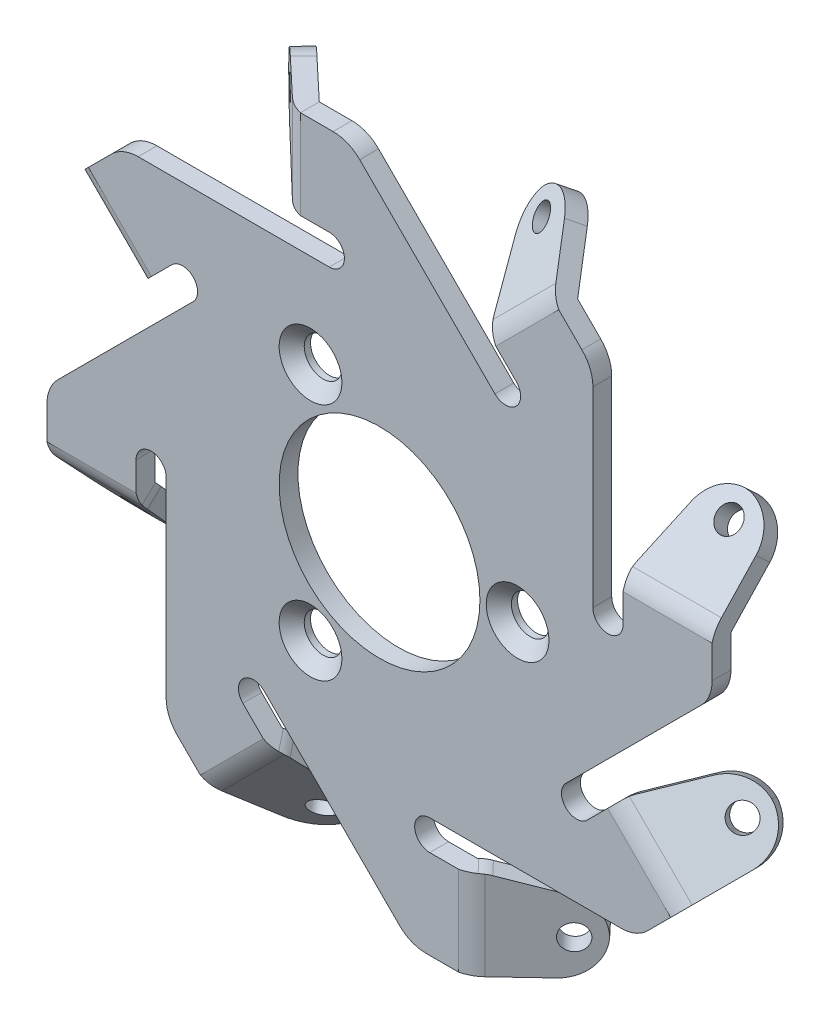
from build123d import *

# Parameters (mm, degrees)
ESQUISSE1_W                    = 53
ESQUISSE1_H                    = 53
BOSS_EXTRU_1_DEPTH             = 1.5
ESQUISSE5_R                    = 8
ENL_V_MAT_EXTRU_4_DEPTH        = 38.506666074
ENL_V_MAT_EXTRU_1_DEPTH        = 38.506666074
ESQUISSE3_W                    = 15
ESQUISSE3_H                    = 20.2
ESQUISSE3_W_2                  = 20.2
ESQUISSE3_H_2                  = 15
ENL_V_MAT_EXTRU_2_DEPTH        = 38.506666074
ENL_V_MAT_EXTRU_3_DEPTH        = 1.5
BOSS_EXTRU_2_DEPTH             = 7.1
R_P_TITION_CIRCULAIRE6_COUNT   = 8
ESQUISSE14_R                   = 1
ENL_V_MAT_EXTRU_5_DEPTH        = 44.23397886
R_P_TITION_CIRCULAIRE7_COUNT   = 8
CONG_1_R                       = 3
R_P_TITION_START               = -5.820655623
R_P_TITION_CIRCULAIRE8_DEPTH   = 1.5
R_P_TITION_CIRCULAIRE8_2_DEPTH = 1.5
R_P_TITION_START_2             = 4.320655623
R_P_TITION_CIRCULAIRE8_3_DEPTH = 1.5
R_P_TITION_CIRCULAIRE8_4_DEPTH = 1.5
R_P_TITION_CIRCULAIRE8_5_DEPTH = 1.5
R_P_TITION_CIRCULAIRE8_6_DEPTH = 1.5
R_P_TITION_CIRCULAIRE8_7_DEPTH = 1.5
CONG_2_R                       = 3
R_P_TITION_START_3             = -26.5
R_P_TITION_CIRCULAIRE9_DEPTH   = 7.1
R_P_TITION_START_4             = 19.4
R_P_TITION_CIRCULAIRE9_2_DEPTH = 7.1
R_P_TITION_CIRCULAIRE9_3_DEPTH = 7.1
R_P_TITION_CIRCULAIRE9_4_DEPTH = 7.1
R_P_TITION_CIRCULAIRE9_5_DEPTH = 7.1
R_P_TITION_CIRCULAIRE9_6_DEPTH = 7.1
R_P_TITION_CIRCULAIRE9_7_DEPTH = 7.1
CONG_3_R                       = 3
R_P_TITION_CIRCULAIRE10_DEPTH  = 1.5
ESQUISSE15_R                   = 1.5
ENL_V_MAT_EXTRU_6_DEPTH        = 39.393130179
CHANFREIN1_SIZE                = 1


# Read off the part's stored shape, not the designer's step: Répétition circulaire8, Répétition circulaire9, Répétition circulaire10
with BuildPart() as part:
    # Esquisse1 → Boss.-Extru.1 (new body)
    with BuildSketch(Plane.XY):
        Rectangle(ESQUISSE1_W, ESQUISSE1_H)
    extrude(amount=BOSS_EXTRU_1_DEPTH)

    # Esquisse5 → Enlèv. mat.-Extru.4 (cut, through all)
    with BuildSketch(Plane.XY.offset(1.5)):
        Circle(ESQUISSE5_R)
    extrude(amount=-ENL_V_MAT_EXTRU_4_DEPTH, mode=Mode.SUBTRACT)

    # Esquisse2 → Enlèv. mat.-Extru.1 (cut, through all)
    with BuildSketch(Plane.XY.offset(1.5)):
        with BuildLine():
            Line((19.4, 26.5), (19.4, 4))
            ThreePointArc((19.4, 4), (18.2, 2.8), (17, 4))
            Line((17, 4), (17, 26.5))
            ThreePointArc((17, 26.5), (18.2, 27.7), (19.4, 26.5))
        make_face()
        with BuildLine():
            Line((32.456201256, 5.020458146), (16.54629868, -10.88944443))
            ThreePointArc((16.54629868, -10.88944443), (14.849242405, -10.88944443), (14.849242405, -9.192388155))
            Line((14.849242405, -9.192388155), (30.759144982, 6.717514421))
            ThreePointArc((30.759144982, 6.717514421), (32.456201256, 6.717514421), (32.456201256, 5.020458146))
        make_face()
        with BuildLine():
            Line((26.5, -19.4), (4, -19.4))
            ThreePointArc((4, -19.4), (2.8, -18.2), (4, -17))
            Line((4, -17), (26.5, -17))
            ThreePointArc((26.5, -17), (27.7, -18.2), (26.5, -19.4))
        make_face()
        with BuildLine():
            Line((5.020458146, -32.456201256), (-10.88944443, -16.54629868))
            ThreePointArc((-10.88944443, -16.54629868), (-10.88944443, -14.849242405), (-9.192388155, -14.849242405))
            Line((-9.192388155, -14.849242405), (6.717514421, -30.759144982))
            ThreePointArc((6.717514421, -30.759144982), (6.717514421, -32.456201256), (5.020458146, -32.456201256))
        make_face()
        with BuildLine():
            Line((-19.4, -26.5), (-19.4, -4))
            ThreePointArc((-19.4, -4), (-18.2, -2.8), (-17, -4))
            Line((-17, -4), (-17, -26.5))
            ThreePointArc((-17, -26.5), (-18.2, -27.7), (-19.4, -26.5))
        make_face()
        with BuildLine():
            Line((-32.456201256, -5.020458146), (-16.54629868, 10.88944443))
            ThreePointArc((-16.54629868, 10.88944443), (-14.849242405, 10.88944443), (-14.849242405, 9.192388155))
            Line((-14.849242405, 9.192388155), (-30.759144982, -6.717514421))
            ThreePointArc((-30.759144982, -6.717514421), (-32.456201256, -6.717514421), (-32.456201256, -5.020458146))
        make_face()
        with BuildLine():
            Line((-26.5, 19.4), (-4, 19.4))
            ThreePointArc((-4, 19.4), (-2.8, 18.2), (-4, 17))
            Line((-4, 17), (-26.5, 17))
            ThreePointArc((-26.5, 17), (-27.7, 18.2), (-26.5, 19.4))
        make_face()
        with BuildLine():
            Line((-5.020458146, 32.456201256), (10.88944443, 16.54629868))
            ThreePointArc((10.88944443, 16.54629868), (10.88944443, 14.849242405), (9.192388155, 14.849242405))
            Line((9.192388155, 14.849242405), (-6.717514421, 30.759144982))
            ThreePointArc((-6.717514421, 30.759144982), (-6.717514421, 32.456201256), (-5.020458146, 32.456201256))
        make_face()
    extrude(amount=-ENL_V_MAT_EXTRU_1_DEPTH, mode=Mode.SUBTRACT)

    # Esquisse3 → Enlèv. mat.-Extru.2 (cut, through all)
    with BuildSketch(Plane.XY.offset(1.5)):
        with Locations((26.9, 16.4)):
            Rectangle(ESQUISSE3_W, ESQUISSE3_H)
        Polygon((18.172644276, -9.263098834), (28.779245994, -19.869700551), (43.062802974, -5.586143571), (32.456201256, 5.020458146), align=None)
        with Locations((16.4, -26.9)):
            Rectangle(ESQUISSE3_W_2, ESQUISSE3_H_2)
        Polygon((-9.263098834, -18.172644276), (-19.869700551, -28.779245994), (-5.586143571, -43.062802974), (5.020458146, -32.456201256), align=None)
        with Locations((-26.9, -16.4)):
            Rectangle(ESQUISSE3_W, ESQUISSE3_H)
        Polygon((-18.172644276, 9.263098834), (-28.779245994, 19.869700551), (-43.062802974, 5.586143571), (-32.456201256, -5.020458146), align=None)
        with Locations((-16.4, 26.9)):
            Rectangle(ESQUISSE3_W_2, ESQUISSE3_H_2)
        Polygon((9.263098834, 18.172644276), (19.869700551, 28.779245994), (5.586143571, 43.062802974), (-5.020458146, 32.456201256), align=None)
    extrude(amount=-ENL_V_MAT_EXTRU_2_DEPTH, mode=Mode.SUBTRACT)

    # Esquisse4 → Enlèv. mat.-Extru.3 (cut)
    with BuildSketch(Plane.XY.offset(1.5)):
        Polygon((14.28355698, 23.193102423), (18.526197667, 18.950461736), (22.768838354, 23.193102423), (18.526197667, 27.43574311), align=None)
        Polygon((27.43574311, -18.526197667), (23.193102423, -14.28355698), (18.950461736, -18.526197667), (23.193102423, -22.768838354), align=None)
        Polygon((-18.526197667, -27.43574311), (-14.28355698, -23.193102423), (-18.526197667, -18.950461736), (-22.768838354, -23.193102423), align=None)
        Polygon((-27.43574311, 18.526197667), (-23.193102423, 14.28355698), (-18.950461736, 18.526197667), (-23.193102423, 22.768838354), align=None)
    extrude(amount=-ENL_V_MAT_EXTRU_3_DEPTH, mode=Mode.SUBTRACT)


with BuildPart() as body_2:
    # Esquisse6 → Boss.-Extru.2 (new body)
    with BuildSketch(Plane(origin=(0, 26.5, 0), x_dir=(1, 0, 0), z_dir=(0, 1, 0))):
        Polygon((-6.3, 0), (-11.758295682, 5.143637647), (-12.787023212, 4.05197851), (-6.895406731, -1.5), (-6.3, -1.5), align=None)
    boss_extru_2 = extrude(amount=-BOSS_EXTRU_2_DEPTH)

    # Esquisse14 → Enlèv. mat.-Extru.5 (cut, through all)
    with BuildSketch(Plane(origin=(-3.991912453, 0, 4.236114594), x_dir=(0.7277727576572095, 0, 0.6858183529273774), z_dir=(-0.6858183529273774, 0, 0.7277727576572095))):
        with Locations((-10.084968373, 23.664285714)):
            Circle(ESQUISSE14_R)
        Polygon((-5.084968373, 19.4), (-12.084968373, 21.4), (-12.084968373, 19.4), align=None)
    enl_v_mat_extru_5 = extrude(amount=-ENL_V_MAT_EXTRU_5_DEPTH, mode=Mode.SUBTRACT)

    # Congé1
    # the kernel refuses this fillet: 3 mm, written as the material it takes off along each edge
    with BuildSketch(Plane(origin=(-8.413005794, 19.4, 1.51321126), x_dir=(-0.6997709349280078, 0.2747211278973797, -0.6594307700712588), z_dir=(0.6858183529273774, 0, -0.7277727576572095))) as cong_1_piece_1:
        with BuildLine():
            CenterArc((CONG_1_R * 0.14005494464, CONG_1_R), CONG_1_R, 254.054604099, 15.945395901)
            Line((-CONG_1_R * 0.134666183257, CONG_1_R * 0.0384760523592), (0, 0))
            Line((0, 0), (CONG_1_R * 0.14005494464, 0))
        make_face()
    extrude(amount=3.60082417, mode=Mode.SUBTRACT)
    with BuildSketch(Plane(origin=(-6.614658035, 26.5, -10.601933329), x_dir=(0.7277727576572104, 0, 0.6858183529273763), z_dir=(-0.6858183529273764, 0, 0.7277727576572105))) as cong_1_piece_2:
        with BuildLine():
            CenterArc((CONG_1_R, -CONG_1_R), CONG_1_R, 90, 90)
            Line((0, -CONG_1_R), (0, 0))
            Line((0, 0), (CONG_1_R, 0))
        make_face()
    extrude(amount=16.5, mode=Mode.SUBTRACT)
    with BuildSketch(Plane(origin=(-16.666876356, 21.4, 0.065221634), x_dir=(0, 1, 0), z_dir=(0.6858183529273774, 0, -0.7277727576572095))) as cong_1_piece_3:
        with BuildLine():
            CenterArc((CONG_1_R * 0.754301412754, CONG_1_R), CONG_1_R, 195.945395901, 74.054604099)
            Line((-CONG_1_R * 0.207222534886, CONG_1_R * 0.725278872103), (0, 0))
            Line((0, 0), (CONG_1_R * 0.754301412754, 0))
        make_face()
    extrude(amount=12.814521191, mode=Mode.SUBTRACT)

    # Congé2
    # the kernel refuses this fillet: 3 mm, written as the material it takes off along each edge
    with BuildSketch(Plane(origin=(-6.895406731, 29.194348497, 1.5), x_dir=(1, 0, 0), z_dir=(0, -1, 0))) as cong_2_piece_1:
        with BuildLine():
            CenterArc((1.273105684, -2.922451732), CONG_2_R, 103.055786516, 30.244213484)
            Line((-0.784349374, -0.739133459), (-0.825498476, -0.695467094))
            Line((-0.825498476, -0.695467094), (-0.041149101, 0.043666365))
            Line((-0.041149101, 0.043666365), (0, 0.06))
            ThreePointArc((0, 0.06), (0.297703365, 0.06), (0.581852752, 0.058449035))
            Line((0.581852752, 0.058449035), (0.595406731, 0))
        make_face()
    extrude(amount=12.488696995, mode=Mode.SUBTRACT)


with BuildPart() as part_1:
    add(part.part)

    # Répétition circulaire6: Boss.-Extru.2 ×8 about axis
    r_p_tition_circulaire6_axis = Axis((0, 0, 0), (0, 0, 1))
    for i in range(1, R_P_TITION_CIRCULAIRE6_COUNT):
        add(boss_extru_2.rotate(r_p_tition_circulaire6_axis, i * 360 / R_P_TITION_CIRCULAIRE6_COUNT))

    # Répétition circulaire7: Enlèv. mat.-Extru.5 ×8 about axis
    r_p_tition_circulaire7_axis = Axis((0, 0, 0), (0, 0, 1))
    for i in range(1, R_P_TITION_CIRCULAIRE7_COUNT):
        add(enl_v_mat_extru_5.rotate(r_p_tition_circulaire7_axis, i * 360 / R_P_TITION_CIRCULAIRE7_COUNT), mode=Mode.SUBTRACT)

    # Répétition circulaire8 outline → Répétition circulaire8 (cut)
    with BuildSketch(Plane(origin=(0, 0, 0), x_dir=(0.8745436486499637, -0.26890985597922773, 0.40356027550198764), z_dir=(0.4849468080171361, 0.4849468080171381, -0.7277727576572101)).offset(R_P_TITION_START)):
        with BuildLine():
            ThreePointArc((-26.177216042, -4.105846504), (-24.386324296, -3.579926665), (-22.631081143, -4.214754514))
            Line((-22.631081143, -4.214754514), (-24.414067393, -2.821307126))
            Line((-24.414067393, -2.821307126), (-28.537640401, -5.822331225))
            Line((-28.537640401, -5.822331225), (-26.772332108, -8.247962407))
            ThreePointArc((-26.772332108, -8.247962407), (-27.316208691, -6.056011832), (-26.177216042, -4.105846504))
        make_face()
        with BuildLine():
            Line((-18.677927253, -7.30424102), (-19.008983296, -7.045512621))
            ThreePointArc((-19.008983296, -7.045512621), (-18.698982985, -7.324587663), (-18.430687098, -7.64396266))
            Line((-18.430687098, -7.64396266), (-18.677927253, -7.30424102))
        make_face()
    extrude(amount=R_P_TITION_CIRCULAIRE8_DEPTH, mode=Mode.SUBTRACT)

    # R_p_tition circulaire8 2 outline → R_p_tition circulaire8 2 (cut)
    with BuildSketch(Plane(origin=(0, 0, 0), x_dir=(1, 0, 0), z_dir=(0, 0.6858183529273764, -0.7277727576572104)).offset(R_P_TITION_START)):
        with BuildLine():
            ThreePointArc((-23.581452119, 12.083862428), (-21.823967614, 11.455266264), (-20.778332395, 9.909131757))
            Line((-20.778332395, 9.909131757), (-21.4, 12.084968373))
            Line((-21.4, 12.084968373), (-26.5, 12.084968373))
            Line((-26.5, 12.084968373), (-26.5, 9.084968373))
            ThreePointArc((-26.5, 9.084968373), (-25.649925157, 11.177292875), (-23.581452119, 12.083862428))
        make_face()
        with BuildLine():
            Line((-19.4, 5.084968373), (-19.515428157, 5.488966923))
            ThreePointArc((-19.515428157, 5.488966923), (-19.428997179, 5.080907175), (-19.4, 4.664803539))
            Line((-19.4, 4.664803539), (-19.4, 5.084968373))
        make_face()
    extrude(amount=R_P_TITION_CIRCULAIRE8_2_DEPTH, mode=Mode.SUBTRACT)

    # R_p_tition circulaire8 3 outline → R_p_tition circulaire8 3 (cut)
    with BuildSketch(Plane(origin=(0, 0, 0), x_dir=(0.8745436486499614, 0.26890985597922834, -0.40356027550199197), z_dir=(0.4849468080171401, -0.4849468080171341, 0.7277727576572101)).offset(R_P_TITION_START_2)):
        with BuildLine():
            Line((-10.191604126, -22.363757867), (-10.969299493, -20.23868716))
            ThreePointArc((-10.969299493, -20.23868716), (-10.904939933, -22.104094024), (-11.956054331, -23.646508834))
            ThreePointArc((-11.956054331, -23.646508834), (-14.16196348, -24.130671912), (-16.080485428, -22.939150785))
            Line((-16.080485428, -22.939150785), (-14.315177135, -25.364781966))
            Line((-14.315177135, -25.364781966), (-10.191604126, -22.363757867))
        make_face()
        with BuildLine():
            ThreePointArc((-12.940809513, -15.18735794), (-12.7194046, -15.540858911), (-12.54917074, -15.921652168))
            Line((-12.54917074, -15.921652168), (-12.693569358, -15.527079581))
            Line((-12.693569358, -15.527079581), (-12.940809513, -15.18735794))
        make_face()
    extrude(amount=R_P_TITION_CIRCULAIRE8_3_DEPTH, mode=Mode.SUBTRACT)

    # R_p_tition circulaire8 4 outline → R_p_tition circulaire8 4 (cut)
    with BuildSketch(Plane(origin=(0, 0, 0), x_dir=(0.7277727576572104, 0, -0.6858183529273765), z_dir=(0.6858183529273764, 0, 0.7277727576572104)).offset(R_P_TITION_START_2)):
        with BuildLine():
            Line((12.084968373, -21.4), (9.909131757, -20.778332395))
            ThreePointArc((9.909131757, -20.778332395), (11.455266264, -21.823967614), (12.083862428, -23.581452119))
            ThreePointArc((12.083862428, -23.581452119), (11.177292875, -25.649925157), (9.084968373, -26.5))
            Line((9.084968373, -26.5), (12.084968373, -26.5))
            Line((12.084968373, -26.5), (12.084968373, -21.4))
        make_face()
        with BuildLine():
            ThreePointArc((4.664803539, -19.4), (5.080907175, -19.428997179), (5.488966923, -19.515428157))
            Line((5.488966923, -19.515428157), (5.084968373, -19.4))
            Line((5.084968373, -19.4), (4.664803539, -19.4))
        make_face()
    extrude(amount=R_P_TITION_CIRCULAIRE8_4_DEPTH, mode=Mode.SUBTRACT)

    # R_p_tition circulaire8 5 outline → R_p_tition circulaire8 5 (cut)
    with BuildSketch(Plane(origin=(0, 0, 0), x_dir=(0.8745436486499657, -0.26890985597922673, -0.4035602755019837), z_dir=(0.4849468080171323, 0.4849468080171413, 0.7277727576572104)).offset(R_P_TITION_START_2)):
        with BuildLine():
            Line((24.414067393, -2.821307126), (22.631081143, -4.214754514))
            ThreePointArc((22.631081143, -4.214754514), (24.386324296, -3.579926665), (26.177216042, -4.105846504))
            ThreePointArc((26.177216042, -4.105846504), (27.316208691, -6.056011832), (26.772332108, -8.247962407))
            Line((26.772332108, -8.247962407), (28.537640401, -5.822331225))
            Line((28.537640401, -5.822331225), (24.414067393, -2.821307126))
        make_face()
        with BuildLine():
            ThreePointArc((18.430687098, -7.64396266), (18.698982985, -7.324587663), (19.008983296, -7.045512621))
            Line((19.008983296, -7.045512621), (18.677927253, -7.30424102))
            Line((18.677927253, -7.30424102), (18.430687098, -7.64396266))
        make_face()
    extrude(amount=R_P_TITION_CIRCULAIRE8_5_DEPTH, mode=Mode.SUBTRACT)

    # R_p_tition circulaire8 6 outline → R_p_tition circulaire8 6 (cut)
    with BuildSketch(Plane(origin=(0, 0, 0), x_dir=(1, 0, 0), z_dir=(0, 0.6858183529273764, 0.7277727576572104)).offset(R_P_TITION_START_2)):
        with BuildLine():
            Line((21.4, 12.084968373), (20.778332395, 9.909131757))
            ThreePointArc((20.778332395, 9.909131757), (21.823967614, 11.455266264), (23.581452119, 12.083862428))
            ThreePointArc((23.581452119, 12.083862428), (25.649925157, 11.177292875), (26.5, 9.084968373))
            Line((26.5, 9.084968373), (26.5, 12.084968373))
            Line((26.5, 12.084968373), (21.4, 12.084968373))
        make_face()
        with BuildLine():
            ThreePointArc((19.4, 4.664803539), (19.428997179, 5.080907175), (19.515428157, 5.488966923))
            Line((19.515428157, 5.488966923), (19.4, 5.084968373))
            Line((19.4, 5.084968373), (19.4, 4.664803539))
        make_face()
    extrude(amount=R_P_TITION_CIRCULAIRE8_6_DEPTH, mode=Mode.SUBTRACT)

    # R_p_tition circulaire8 7 outline → R_p_tition circulaire8 7 (cut)
    with BuildSketch(Plane(origin=(0, 0, 0), x_dir=(0.8745436486499597, 0.26890985597922884, 0.4035602755019952), z_dir=(0.48494680801714307, -0.4849468080171311, -0.7277727576572101)).offset(R_P_TITION_START)):
        with BuildLine():
            ThreePointArc((11.956054331, -23.646508834), (10.904939933, -22.104094024), (10.969299493, -20.23868716))
            Line((10.969299493, -20.23868716), (10.191604126, -22.363757867))
            Line((10.191604126, -22.363757867), (14.315177135, -25.364781966))
            Line((14.315177135, -25.364781966), (16.080485428, -22.939150785))
            ThreePointArc((16.080485428, -22.939150785), (14.16196348, -24.130671912), (11.956054331, -23.646508834))
        make_face()
        with BuildLine():
            Line((12.693569358, -15.527079581), (12.54917074, -15.921652168))
            ThreePointArc((12.54917074, -15.921652168), (12.7194046, -15.540858911), (12.940809513, -15.18735794))
            Line((12.940809513, -15.18735794), (12.693569358, -15.527079581))
        make_face()
    extrude(amount=R_P_TITION_CIRCULAIRE8_7_DEPTH, mode=Mode.SUBTRACT)

    # Répétition circulaire9 outline → Répétition circulaire9 (cut)
    with BuildSketch(Plane(origin=(0, 0, 0), x_dir=(0.707106781186546, 0.707106781186549, 0), z_dir=(0.707106781186549, -0.707106781186546, 0)).offset(R_P_TITION_START_3)):
        with BuildLine():
            Line((-6.895406731, 1.5), (-7.679756105, 0.760866541))
            ThreePointArc((-7.679756105, 0.760866541), (-7.038933121, 1.222005407), (-6.3, 1.5))
            Line((-6.3, 1.5), (-6.895406731, 1.5))
        make_face()
    extrude(amount=R_P_TITION_CIRCULAIRE9_DEPTH, mode=Mode.SUBTRACT)

    # R_p_tition circulaire9 2 outline → R_p_tition circulaire9 2 (cut)
    with BuildSketch(Plane(origin=(0, 0, 0), x_dir=(0.707106781186546, 0.707106781186549, 0), z_dir=(0.707106781186549, -0.707106781186546, 0)).offset(R_P_TITION_START_4)):
        with BuildLine():
            Line((6.895406731, 1.5), (6.3, 1.5))
            ThreePointArc((6.3, 1.5), (7.038933121, 1.222005407), (7.679756105, 0.760866541))
            Line((7.679756105, 0.760866541), (6.895406731, 1.5))
        make_face()
    extrude(amount=R_P_TITION_CIRCULAIRE9_2_DEPTH, mode=Mode.SUBTRACT)

    # R_p_tition circulaire9 3 outline → R_p_tition circulaire9 3 (cut)
    with BuildSketch(Plane.YZ.offset(R_P_TITION_START_3)):
        with BuildLine():
            Line((-6.895406731, 1.5), (-7.679756105, 0.760866541))
            ThreePointArc((-7.679756105, 0.760866541), (-7.038933121, 1.222005407), (-6.3, 1.5))
            Line((-6.3, 1.5), (-6.895406731, 1.5))
        make_face()
    extrude(amount=R_P_TITION_CIRCULAIRE9_3_DEPTH, mode=Mode.SUBTRACT)

    # R_p_tition circulaire9 4 outline → R_p_tition circulaire9 4 (cut)
    with BuildSketch(Plane.YZ.offset(R_P_TITION_START_4)):
        with BuildLine():
            Line((6.895406731, 1.5), (6.3, 1.5))
            ThreePointArc((6.3, 1.5), (7.038933121, 1.222005407), (7.679756105, 0.760866541))
            Line((7.679756105, 0.760866541), (6.895406731, 1.5))
        make_face()
    extrude(amount=R_P_TITION_CIRCULAIRE9_4_DEPTH, mode=Mode.SUBTRACT)

    # R_p_tition circulaire9 5 outline → R_p_tition circulaire9 5 (cut)
    with BuildSketch(Plane(origin=(0, 0, 0), x_dir=(0.7071067811865509, -0.707106781186544, 0), z_dir=(0.707106781186544, 0.707106781186551, 0)).offset(R_P_TITION_START_3)):
        with BuildLine():
            Line((6.895406731, -1.5), (7.679756105, -0.760866541))
            ThreePointArc((7.679756105, -0.760866541), (7.038933121, -1.222005407), (6.3, -1.5))
            Line((6.3, -1.5), (6.895406731, -1.5))
        make_face()
    extrude(amount=R_P_TITION_CIRCULAIRE9_5_DEPTH, mode=Mode.SUBTRACT)

    # R_p_tition circulaire9 6 outline → R_p_tition circulaire9 6 (cut)
    with BuildSketch(Plane(origin=(0, 0, 0), x_dir=(0.7071067811865509, -0.707106781186544, 0), z_dir=(0.707106781186544, 0.707106781186551, 0)).offset(R_P_TITION_START_4)):
        with BuildLine():
            Line((-6.895406731, -1.5), (-6.3, -1.5))
            ThreePointArc((-6.3, -1.5), (-7.038933121, -1.222005407), (-7.679756105, -0.760866541))
            Line((-7.679756105, -0.760866541), (-6.895406731, -1.5))
        make_face()
    extrude(amount=R_P_TITION_CIRCULAIRE9_6_DEPTH, mode=Mode.SUBTRACT)

    # R_p_tition circulaire9 7 outline → R_p_tition circulaire9 7 (cut)
    with BuildSketch(Plane(origin=(0, 0, 0), x_dir=(1, 0, 0), z_dir=(0, 1, 0)).offset(R_P_TITION_START_3)):
        with BuildLine():
            Line((6.895406731, -1.5), (7.679756105, -0.760866541))
            ThreePointArc((7.679756105, -0.760866541), (7.038933121, -1.222005407), (6.3, -1.5))
            Line((6.3, -1.5), (6.895406731, -1.5))
        make_face()
    extrude(amount=R_P_TITION_CIRCULAIRE9_7_DEPTH, mode=Mode.SUBTRACT)

    # Congé3
    cong_3_edges = [part_1.edges().sort_by_distance(p)[0] for p in [
        (-2.45836944, 26.5, 0.75),
    ]]
    fillet(cong_3_edges, radius=CONG_3_R)

    # Répétition circulaire10 outline → Répétition circulaire10 (cut)
    with BuildSketch(Plane.XY):
        with BuildLine():
            Line((-20.476659403, 17), (-21.355339059, 16.121320344))
            ThreePointArc((-21.355339059, 16.121320344), (-20.382069013, 16.771638598), (-19.234018716, 17))
            Line((-19.234018716, 17), (-20.476659403, 17))
        make_face()
        with BuildLine():
            Line((-26.5, -2.45836944), (-26.5, -3.701010127))
            ThreePointArc((-26.5, -3.701010127), (-26.271638598, -2.55295983), (-25.621320344, -1.579689783))
            Line((-25.621320344, -1.579689783), (-26.5, -2.45836944))
        make_face()
        with BuildLine():
            Line((-17, -20.476659403), (-16.121320344, -21.355339059))
            ThreePointArc((-16.121320344, -21.355339059), (-16.771638598, -20.382069013), (-17, -19.234018716))
            Line((-17, -19.234018716), (-17, -20.476659403))
        make_face()
        with BuildLine():
            Line((2.45836944, -26.5), (3.701010127, -26.5))
            ThreePointArc((3.701010127, -26.5), (2.55295983, -26.271638598), (1.579689783, -25.621320344))
            Line((1.579689783, -25.621320344), (2.45836944, -26.5))
        make_face()
        with BuildLine():
            Line((20.476659403, -17), (21.355339059, -16.121320344))
            ThreePointArc((21.355339059, -16.121320344), (20.382069013, -16.771638598), (19.234018716, -17))
            Line((19.234018716, -17), (20.476659403, -17))
        make_face()
        with BuildLine():
            Line((26.5, 2.45836944), (26.5, 3.701010127))
            ThreePointArc((26.5, 3.701010127), (26.271638598, 2.55295983), (25.621320344, 1.579689783))
            Line((25.621320344, 1.579689783), (26.5, 2.45836944))
        make_face()
        with BuildLine():
            Line((17, 20.476659403), (16.121320344, 21.355339059))
            ThreePointArc((16.121320344, 21.355339059), (16.771638598, 20.382069013), (17, 19.234018716))
            Line((17, 19.234018716), (17, 20.476659403))
        make_face()
    extrude(amount=R_P_TITION_CIRCULAIRE10_DEPTH, mode=Mode.SUBTRACT)

    # Esquisse15 → Enlèv. mat.-Extru.6 (cut, through all)
    with BuildSketch(Plane.XY.offset(1.5)):
        with Locations((11, 0)):
            Circle(ESQUISSE15_R)
        with Locations((-5.5, -9.526279442)):
            Circle(ESQUISSE15_R)
        with Locations((-5.5, 9.526279442)):
            Circle(ESQUISSE15_R)
    extrude(amount=-ENL_V_MAT_EXTRU_6_DEPTH, mode=Mode.SUBTRACT)

    # Chanfrein1
    chanfrein1_edges = [part_1.edges().sort_by_distance(p)[0] for p in [
        (9.5, 0, 1.5),
        (-7, -9.526279442, 1.5),
        (-7, 9.526279442, 1.5),
    ]]
    chamfer(chanfrein1_edges, length=CHANFREIN1_SIZE)


solid = Compound([body_2.part, part_1.part])
